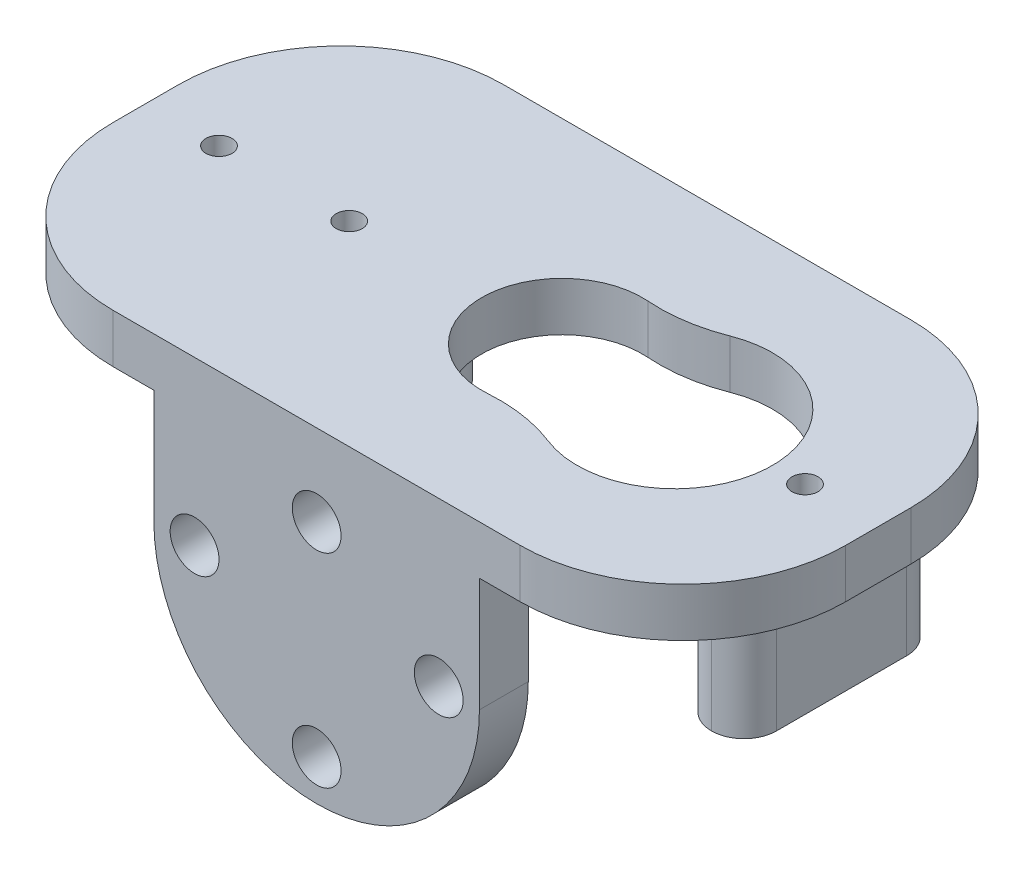
from build123d import *

# Parameters (mm, degrees)
SKETCH1_W           = 45
SKETCH1_H           = 24
BOSS_EXTRUDE1_DEPTH = 3
SKETCH2_R           = 0.8
CUT_EXTRUDE1_DEPTH  = 26.675864153
SKETCH3_W           = 4
SKETCH3_H           = 12
BOSS_EXTRUDE2_DEPTH = 7
SKETCH4_R           = 0.8
CUT_EXTRUDE2_DEPTH  = 5
FILLET1_R           = 2
FILLET2_R           = 10
SKETCH6_W           = 20
SKETCH6_H           = 3
BOSS_EXTRUDE3_DEPTH = 17
FILLET3_R           = 10
SKETCH7_R           = 1.5
CUT_EXTRUDE3_DEPTH  = 3


with BuildPart() as part:
    # Sketch1 → Boss-Extrude1 (new body)
    with BuildSketch(Plane(origin=(0, 0, 0), x_dir=(1, 0, 0), z_dir=(0, 1, 0))):
        Rectangle(SKETCH1_W, SKETCH1_H)
    extrude(amount=BOSS_EXTRUDE1_DEPTH)

    # Sketch2 → Cut-Extrude1 (cut, through all)
    with BuildSketch(Plane(origin=(0, 3, 0), x_dir=(1, 0, 0), z_dir=(0, 1, 0))):
        with Locations(Location((18, 0, 0), (0, 0, 270))):
            Circle(SKETCH2_R)
        with Locations(Location((-10, 0, 0), (0, 0, 270))):
            Circle(SKETCH2_R)
        with Locations(Location((-18, 0, 0), (0, 0, 270))):
            Circle(SKETCH2_R)
        with BuildLine():
            ThreePointArc((7.809591844, -5.585885079), (16, 0), (7.809591844, 5.585885079))
            ThreePointArc((7.809591844, 5.585885079), (5.65712524, 5.008562723), (3.430251149, 4.922276176))
            ThreePointArc((3.430251149, 4.922276176), (-1.864767372, 0), (3.430251149, -4.922276176))
            ThreePointArc((3.430251149, -4.922276176), (5.65712524, -5.008562723), (7.809591844, -5.585885079))
        make_face()
    extrude(amount=-CUT_EXTRUDE1_DEPTH, mode=Mode.SUBTRACT)

    # Sketch3 → Boss-Extrude2 (add)
    with BuildSketch(Plane.XZ):
        with Locations((-9.25, 0)):
            Rectangle(SKETCH3_W, SKETCH3_H)
        with Locations((18.25, 0)):
            Rectangle(SKETCH3_W, SKETCH3_H)
    extrude(amount=BOSS_EXTRUDE2_DEPTH)

    # Sketch4 → Cut-Extrude2 (cut)
    with BuildSketch(Plane.XZ.offset(7)):
        with Locations(Location((18.25, 0, 0), (0, 0, 270))):
            Circle(SKETCH4_R)
        with Locations(Location((-9.25, 0, 0), (0, 0, 270))):
            Circle(SKETCH4_R)
    extrude(amount=-CUT_EXTRUDE2_DEPTH, mode=Mode.SUBTRACT)

    # Fillet1
    fillet1_edges = [part.edges().sort_by_distance(p)[0] for p in [
        (16.25, -3.5, -6),
        (-11.25, -3.5, -6),
        (-7.25, -3.5, -6),
        (20.25, -3.5, -6),
        (-11.25, -3.5, 6),
        (-7.25, -3.5, 6),
        (16.25, -3.5, 6),
        (20.25, -3.5, 6),
    ]]
    fillet(fillet1_edges, radius=FILLET1_R - 0.0001)  # a hair under: the kernel refuses the full size

    # Fillet2
    fillet2_edges = [part.edges().sort_by_distance(p)[0] for p in [
        (-22.5, 1.5, -12),
        (22.5, 1.5, -12),
        (22.5, 1.5, 12),
        (-22.5, 1.5, 12),
    ]]
    fillet(fillet2_edges, radius=FILLET2_R)

    # Sketch6 → Boss-Extrude3 (add)
    with BuildSketch(Plane.XZ):
        with Locations((0, 10.5)):
            Rectangle(SKETCH6_W, SKETCH6_H)
    extrude(amount=BOSS_EXTRUDE3_DEPTH)

    # Fillet3
    fillet3_edges = [part.edges().sort_by_distance(p)[0] for p in [
        (-10, -17, 10.5),
        (10, -17, 10.5),
    ]]
    fillet(fillet3_edges, radius=FILLET3_R - 0.0001)  # a hair under: the kernel refuses the full size

    # Sketch7 → Cut-Extrude3 (cut)
    with BuildSketch(Plane.XY.offset(12)):
        with Locations((0, -14.5)):
            Circle(SKETCH7_R)
        with Locations((0, -2)):
            Circle(SKETCH7_R)
        with Locations((7.5, -7)):
            Circle(SKETCH7_R)
        with Locations((-7.5, -7)):
            Circle(SKETCH7_R)
    extrude(amount=-CUT_EXTRUDE3_DEPTH, mode=Mode.SUBTRACT)


solid = part.part
